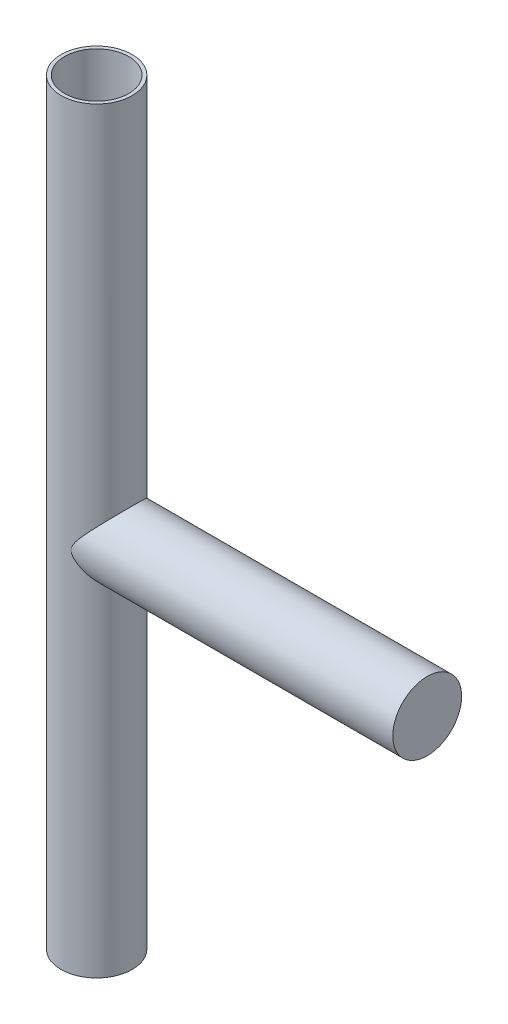
from build123d import *

# Parameters (mm, degrees)
BOSS_EXTRUDE1_DEPTH      = 160
BOSS_EXTRUDE1_DEPTH_BACK = 5
SKETCH1_R                = 7.75
SKETCH1_R_2              = 7
SKETCH5_R                = 7.5
BOSS_EXTRUDE3_DEPTH      = 72.0622032


with BuildPart() as part:
    # Sketch1 → Boss-Extrude1 (new, two sides: drawn at the far end of the back side and taken through both)
    with BuildSketch(Plane(origin=(0, 0, 0), x_dir=(1, 0, 0), z_dir=(0, 1, 0)).offset(-BOSS_EXTRUDE1_DEPTH_BACK)):
        Circle(SKETCH1_R)
        Circle(SKETCH1_R_2, mode=Mode.SUBTRACT)
    extrude(amount=BOSS_EXTRUDE1_DEPTH + BOSS_EXTRUDE1_DEPTH_BACK)

    # Sketch5 → Boss-Extrude3 (add)
    with BuildSketch(Plane(origin=(0, 0, 0), x_dir=(0, 0, -1), z_dir=(1, 0, 0))):
        with Locations((0, 75)):
            Circle(SKETCH5_R)
    extrude(amount=BOSS_EXTRUDE3_DEPTH)


solid = part.part
